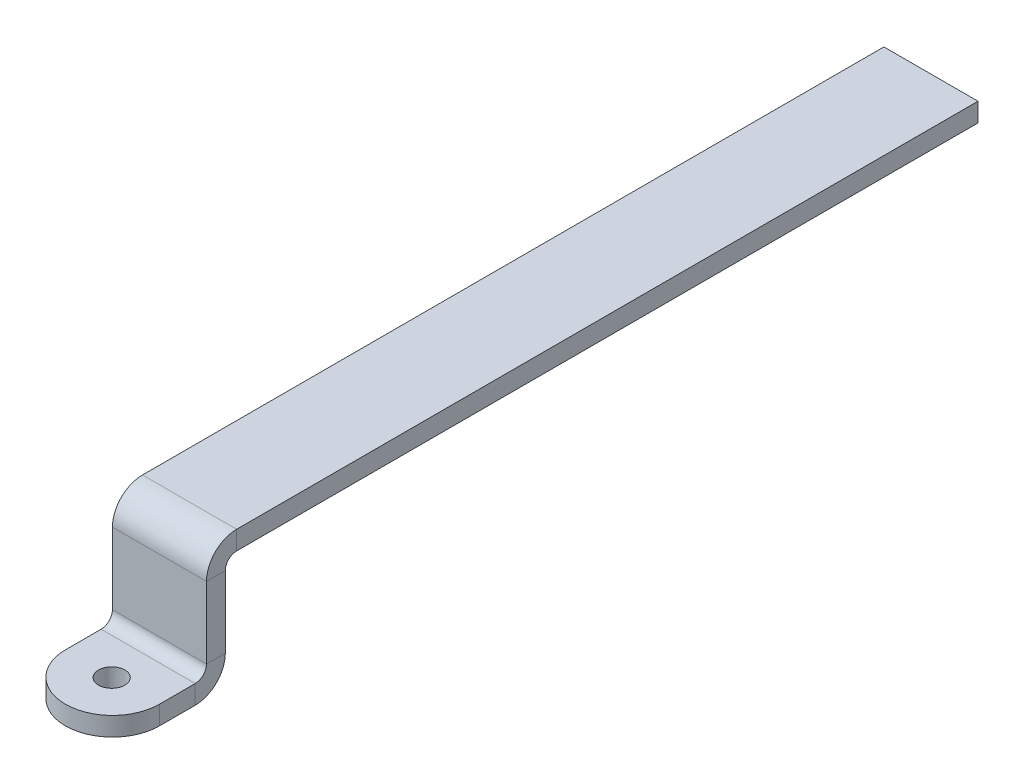
from build123d import *

# Parameters (mm, degrees)
BASE_FLANGE1_DEPTH = 0.625
FILLET1_RADIUS     = 0.625
FILLET1_LENGTH     = 0.25
HOLE1_START        = -1.5
HOLE1_OUTLINE_R    = 0.175
HOLE1_DEPTH        = 0.25


# Read off the part's stored shape, not the designer's step: Hole1
# Sheet-metal steps are written as plain solids
with BuildPart() as part:
    # Sketch1 → Base-Flange1 (new, symmetric)
    with BuildSketch(Plane(origin=(0, 0, 0), x_dir=(0, 0, -1), z_dir=(1, 0, 0))):
        with BuildLine():
            Line((10, 0), (0.15, 0))
            ThreePointArc((0.15, 0), (0.043933983, -0.043933983), (0, -0.15))
            Line((0, -0.15), (0, -1.1))
            ThreePointArc((0, -1.1), (-0.117157288, -1.382842712), (-0.4, -1.5))
            Line((-0.4, -1.5), (-1.5, -1.5))
            Line((-1.5, -1.5), (-1.5, -1.25))
            Line((-1.5, -1.25), (-0.4, -1.25))
            ThreePointArc((-0.4, -1.25), (-0.293933983, -1.206066017), (-0.25, -1.1))
            Line((-0.25, -1.1), (-0.25, -0.15))
            ThreePointArc((-0.25, -0.15), (-0.132842712, 0.132842712), (0.15, 0.25))
            Line((0.15, 0.25), (10, 0.25))
            Line((10, 0.25), (10, 0))
        make_face()
    extrude(amount=BASE_FLANGE1_DEPTH, both=True)

    # Fillet1: full round fillet: the end face becomes a half cylinder, R = half its width
    fillet1_face = Plane((0, -1.375, 1.5), x_dir=(0, -1, 0), z_dir=(0, 0, 1))  # on the end face: x along it, z out of the body
    fillet1_slab = fillet1_face.offset(-FILLET1_RADIUS / 2) * Box(FILLET1_LENGTH, 2 * FILLET1_RADIUS, FILLET1_RADIUS, mode=Mode.PRIVATE)  # the body's end, R deep
    fillet1_round = Plane((0, -1.375, 0.875), x_dir=(0, 0, 1), z_dir=(0, -1, 0)) * Cylinder(FILLET1_RADIUS, FILLET1_LENGTH, mode=Mode.PRIVATE)  # its axis R under the face
    add(fillet1_slab - fillet1_round, mode=Mode.SUBTRACT)

    # Hole1 outline → Hole1 (cut)
    with BuildSketch(Plane(origin=(0, 0, 0), x_dir=(1, 0, 0), z_dir=(0, 1, 0)).offset(HOLE1_START)):
        with Locations((0.001471382, -0.886025874)):
            Circle(HOLE1_OUTLINE_R)
    extrude(amount=HOLE1_DEPTH, mode=Mode.SUBTRACT)


solid = part.part
